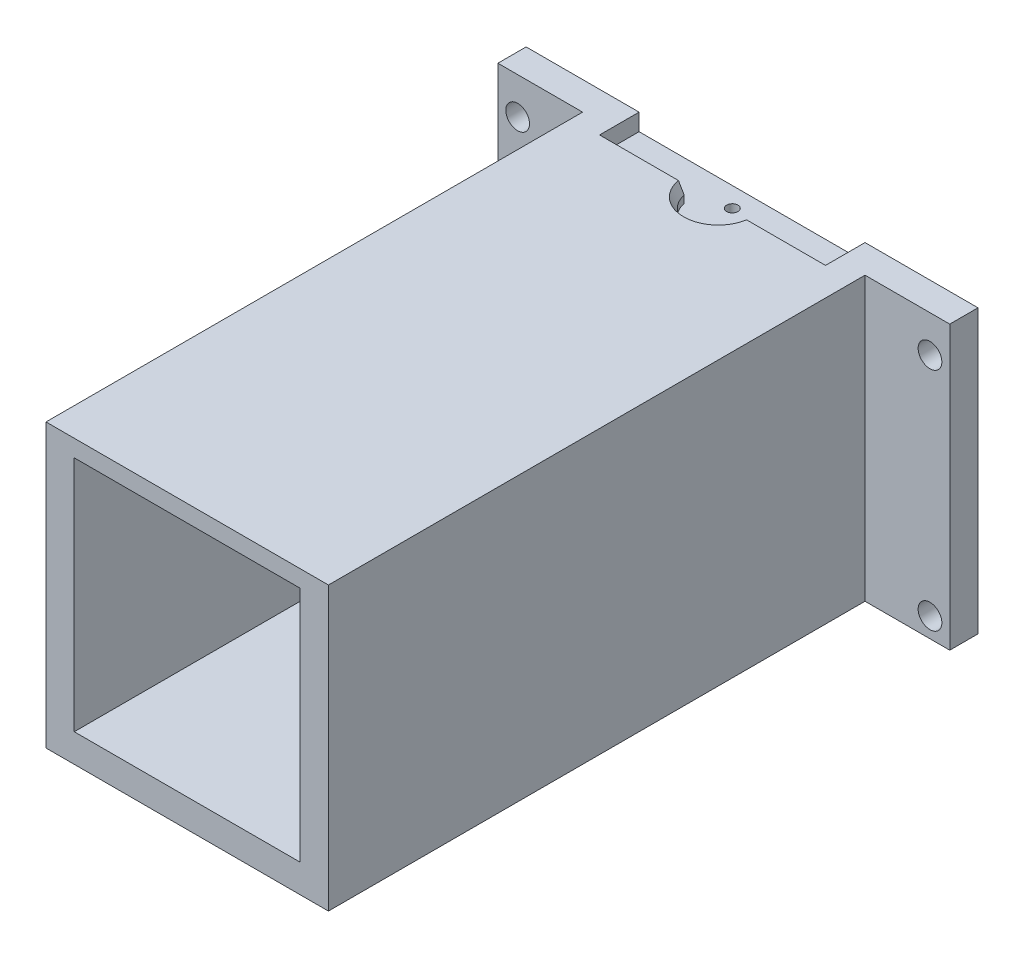
from build123d import *

# Parameters (mm, degrees)
SKETCH_1_W          = 80
SKETCH_1_H          = 50
EXTRUDE_1_DEPTH     = 5
SKETCH_2_W          = 50
SKETCH_2_H          = 50
EXTRUDE_2_DEPTH     = 100
SKETCH_4_W          = 40
SKETCH_4_H          = 42
CUT_EXTRUDE_1_DEPTH = 138.477270849
SKETCH_5_R          = 2.1
CUT_EXTRUDE_2_DEPTH = 10
CUT_EXTRUDE_START   = 10
SKETCH_7_W          = 40
SKETCH_7_H          = 7
CUT_EXTRUDE_7_DEPTH = 128.477270849
EXTRUDE_START       = 44.5
SKETCH_8_W          = 50
SKETCH_8_H          = 15
EXTRUDE_6_DEPTH     = 2.5
SKETCH_9_R          = 1
CUT_EXTRUDE_8_DEPTH = 128.477270849
CHAMFER_2_SIZE      = 4.4
CHAMFER_2_SIZE_2    = 2.540341184
CUT_EXTRUDE_START_2 = 47
SKETCH_14_R         = 5.11141812
CUT_EXTRUDE_9_DEPTH = 91.477270849
CHAMFER_3_SIZE      = 1
CHAMFER_3_SIZE2     = 1.732050808


with BuildPart() as part:
    # 草圖1 → 填料-伸長1 (new body)
    with BuildSketch(Plane.XY):
        with Locations((40, 25)):
            Rectangle(SKETCH_1_W, SKETCH_1_H)
    extrude(amount=EXTRUDE_1_DEPTH)

    # 草圖2 → 填料-伸長2 (add)
    with BuildSketch(Plane.XY):
        with Locations((40, 25)):
            Rectangle(SKETCH_2_W, SKETCH_2_H)
    extrude(amount=EXTRUDE_2_DEPTH)

    # 草圖4 → 除料-伸長1 (cut, through all)
    with BuildSketch(Plane.XY):
        with Locations((40, 26)):
            Rectangle(SKETCH_4_W, SKETCH_4_H)
    extrude(amount=CUT_EXTRUDE_1_DEPTH, mode=Mode.SUBTRACT)

    # 草圖5 → 除料-伸長2 (cut)
    with BuildSketch(Plane.XY):
        with Locations(Location((76.5, 3.5, 0), (0, 0, 180))):
            Circle(SKETCH_5_R)
        with Locations(Location((76.5, 43.5, 0), (0, 0, 180))):
            Circle(SKETCH_5_R)
        with Locations(Location((3.5, 3.5, 0), (0, 0, 180))):
            Circle(SKETCH_5_R)
        with Locations(Location((3.5, 43.5, 0), (0, 0, 180))):
            Circle(SKETCH_5_R)
    extrude(amount=CUT_EXTRUDE_2_DEPTH, mode=Mode.SUBTRACT)

    # 草圖7 → 除料-伸長7 (cut, through all)
    with BuildSketch(Plane(origin=(0, 0, 0), x_dir=(1, 0, 0), z_dir=(0, 1, 0)).offset(CUT_EXTRUDE_START)):
        with Locations((40, -3.5)):
            Rectangle(SKETCH_7_W, SKETCH_7_H)
    extrude(amount=CUT_EXTRUDE_7_DEPTH, mode=Mode.SUBTRACT)

    # 草圖8 → 填料-伸長6 (add)
    with BuildSketch(Plane(origin=(0, 0, 0), x_dir=(1, 0, 0), z_dir=(0, 1, 0)).offset(EXTRUDE_START)):
        with Locations((40, -7.5)):
            Rectangle(SKETCH_8_W, SKETCH_8_H)
    extrude(amount=EXTRUDE_6_DEPTH)

    # 草圖9 → 除料-伸長8 (cut, through all)
    with BuildSketch(Plane(origin=(0, 0, 0), x_dir=(1, 0, 0), z_dir=(0, 1, 0)).offset(CUT_EXTRUDE_START)):
        with Locations(Location((40, -3.5, 0), (0, 0, 270))):
            Circle(SKETCH_9_R)
    extrude(amount=CUT_EXTRUDE_8_DEPTH, mode=Mode.SUBTRACT)

    # 導角2
    # the kernel refuses this chamfer: 4.4, 2.540341184 mm, written as the material it takes off along each edge
    with BuildSketch(Plane(origin=(60, 44.5, 15), x_dir=(0, -0.01932676561270091, -0.9998132206222078), z_dir=(-1, 0, 0))) as chamfer_2_piece_1_section:
        Polygon((CHAMFER_2_SIZE * 0.999813220622, -CHAMFER_2_SIZE * 0.0193267656127), (-CHAMFER_2_SIZE_2 * 0.019326765616, -CHAMFER_2_SIZE_2 * 0.999813220793), (0, 0), align=None)
    chamfer_2_piece_1 = extrude(amount=40, mode=Mode.PRIVATE)
    chamfer_2_piece_1 = split(chamfer_2_piece_1, bisect_by=Plane(origin=(40, 47, 13.532969249), z_dir=(0, -1, 0)), keep=Keep.TOP, mode=Mode.PRIVATE)
    add(chamfer_2_piece_1, mode=Mode.SUBTRACT)

    # 草圖14 → 除料-伸長9 (cut, through all)
    with BuildSketch(Plane(origin=(0, 0, 0), x_dir=(1, 0, 0), z_dir=(0, 1, 0)).offset(CUT_EXTRUDE_START_2)):
        with Locations((40, -6)):
            Circle(SKETCH_14_R)
    extrude(amount=CUT_EXTRUDE_9_DEPTH, mode=Mode.SUBTRACT)

    # 導角3
    chamfer_3_edges = [part.edges().sort_by_distance(p)[0] for p in [
        (40, 50, 11.11141812),
    ]]
    chamfer_3_side = [part.faces().sort_by_distance(p)[0] for p in [
        (40, 50, 51.481645062),
    ]]
    chamfer(chamfer_3_edges, length=CHAMFER_3_SIZE, length2=CHAMFER_3_SIZE2, reference=chamfer_3_side[0])


solid = part.part
